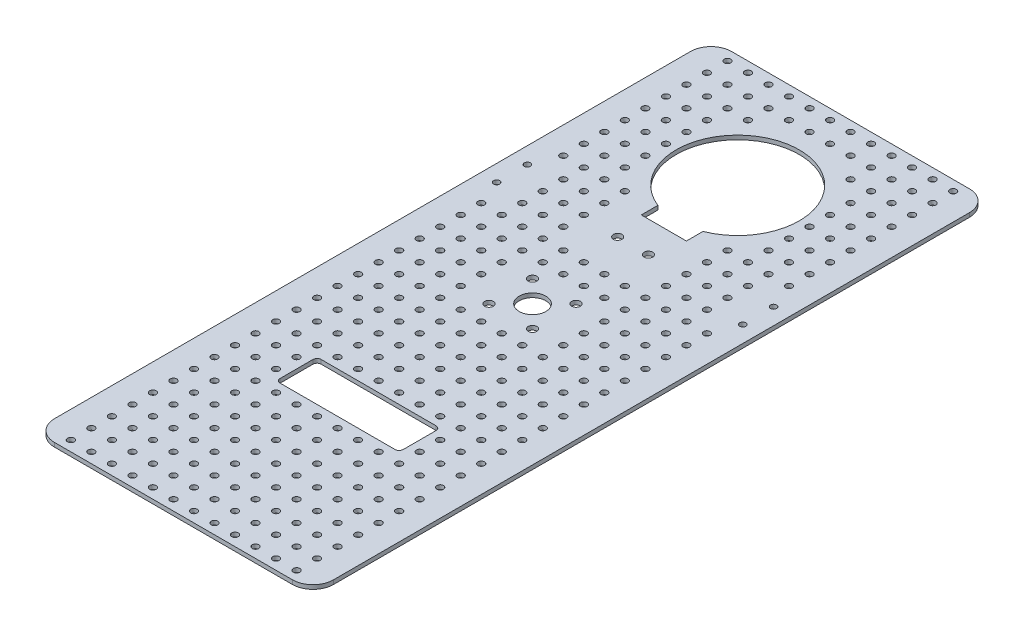
from build123d import *

# Parameters (mm, degrees)
SKETCH_1_W              = 136
SKETCH_1_H              = 330
EXTRUDE_572_DEPTH       = 2
SKETCH_12_R             = 1.5
CUT_EXTRUDE_1067_DEPTH  = 198.111643492
SKETCH_9_R              = 6.5
SKETCH_9_R_2            = 2.1
CUT_EXTRUDE_1882_DEPTH  = 198.111643492
FILLET_4_R              = 10
CUT_EXTRUDE_6977_REACH  = 199.112
SKETCH_18_R             = 2.1
FILLET_9_R              = 10
SKETCH_22_R             = 1.6
CUT_EXTRUDE_10_DEPTH    = 2
SKETCH_11_W             = 60
SKETCH_11_H             = 20
CUT_EXTRUDE_12810_DEPTH = 198.111643492
FILLET_3_R              = 2


with BuildPart() as part:
    # Эскиз1 → Extrude 572 (new body)
    with BuildSketch(Plane(origin=(0, 0, 0), x_dir=(1, 0, 0), z_dir=(0, 1, 0))):
        with Locations((0, -20)):
            Rectangle(SKETCH_1_W, SKETCH_1_H)
    extrude(amount=EXTRUDE_572_DEPTH)

    # Эскиз12 → Cut-Extrude 1067 (cut, through all)
    with BuildSketch(Plane(origin=(0, 2, 0), x_dir=(1, 0, 0), z_dir=(0, 1, 0))):
        with Locations(Location((60, 47.5, 0), (0, 0, 270))):
            Circle(SKETCH_12_R)
        with Locations(Location((-60, 47.5, 0), (0, 0, 270))):
            Circle(SKETCH_12_R)
        with Locations(Location((-60, 32.5, 0), (0, 0, 270))):
            Circle(SKETCH_12_R)
        with Locations(Location((60, 32.5, 0), (0, 0, 270))):
            Circle(SKETCH_12_R)
    extrude(amount=-CUT_EXTRUDE_1067_DEPTH, mode=Mode.SUBTRACT)

    # Эскиз9 → Cut-Extrude 1882 (cut, through all)
    with BuildSketch(Plane(origin=(0, 2, 0), x_dir=(1, 0, 0), z_dir=(0, 1, 0))):
        with Locations(Location((0, -10, 0), (0, 0, 270))):
            Circle(SKETCH_9_R)
        with Locations(Location((-10.606601718, 0.606601718, 0), (0, 0, 270))):
            Circle(SKETCH_9_R_2)
        with Locations(Location((10.606601718, 0.606601718, 0), (0, 0, 270))):
            Circle(SKETCH_9_R_2)
        with Locations(Location((10.606601718, -20.606601718, 0), (0, 0, 270))):
            Circle(SKETCH_9_R_2)
        with Locations(Location((-10.606601718, -20.606601718, 0), (0, 0, 270))):
            Circle(SKETCH_9_R_2)
    extrude(amount=-CUT_EXTRUDE_1882_DEPTH, mode=Mode.SUBTRACT)

    # Скругление4
    fillet_4_edges = [part.edges().sort_by_distance(p)[0] for p in [
        (-68, 1, -145),
        (68, 1, -145),
    ]]
    fillet(fillet_4_edges, radius=FILLET_4_R)

    # Эскиз18 → Cut-Extrude 6977 (cut, up to next)
    with BuildSketch(Plane(origin=(0, 2, 0), x_dir=(1, 0, 0), z_dir=(0, 1, 0)), mode=Mode.PRIVATE) as cut_extrude_6977_sk1:
        with Locations(Location((7.5, 39, 0), (0, 0, 270))):
            Circle(SKETCH_18_R)
    cut_extrude_6977_tool1 = extrude(cut_extrude_6977_sk1.sketch, amount=-CUT_EXTRUDE_6977_REACH, mode=Mode.PRIVATE) & part.part
    # Эскиз18 → Cut-Extrude 6977 (cut, up to next)
    with BuildSketch(Plane(origin=(0, 2, 0), x_dir=(1, 0, 0), z_dir=(0, 1, 0)), mode=Mode.PRIVATE) as cut_extrude_6977_sk2:
        with Locations(Location((-7.5, 39, 0), (0, 0, 270))):
            Circle(SKETCH_18_R)
    cut_extrude_6977_tool2 = extrude(cut_extrude_6977_sk2.sketch, amount=-CUT_EXTRUDE_6977_REACH, mode=Mode.PRIVATE) & part.part
    # Эскиз18 → Cut-Extrude 6977 (cut, up to next)
    with BuildSketch(Plane(origin=(0, 2, 0), x_dir=(1, 0, 0), z_dir=(0, 1, 0)), mode=Mode.PRIVATE) as cut_extrude_6977_sk3:
        with BuildLine():
            Line((-11, 54), (11, 54))
            Line((11, 54), (11, 62.089428526))
            ThreePointArc((11, 62.089428526), (0, 120), (-11, 62.089428526))
            Line((-11, 62.089428526), (-11, 54))
        make_face()
    cut_extrude_6977_tool3 = extrude(cut_extrude_6977_sk3.sketch, amount=-CUT_EXTRUDE_6977_REACH, mode=Mode.PRIVATE) & part.part
    add(cut_extrude_6977_tool1.solids().sort_by_distance((7.5, 2, -39))[0], mode=Mode.SUBTRACT)
    add(cut_extrude_6977_tool2.solids().sort_by_distance((-7.5, 2, -39))[0], mode=Mode.SUBTRACT)
    add(cut_extrude_6977_tool3.solids().sort_by_distance((0, 2, -88.386415))[0], mode=Mode.SUBTRACT)

    # Скругление9
    fillet_9_edges = [part.edges().sort_by_distance(p)[0] for p in [
        (68, 1, 185),
        (-68, 1, 185),
    ]]
    fillet(fillet_9_edges, radius=FILLET_9_R)

    # Эскиз22 → Сетка 10мм (cut)
    with BuildSketch(Plane(origin=(0, 2, 0), x_dir=(1, 0, 0), z_dir=(0, 1, 0))):
        with Locations(Location((-5, -180, 0), (0, 0, 270))):
            Circle(SKETCH_22_R)
        with Locations(Location((-15, -180, 0), (0, 0, 270))):
            Circle(SKETCH_22_R)
        with Locations(Location((-25, -180, 0), (0, 0, 270))):
            Circle(SKETCH_22_R)
        with Locations(Location((-35, -180, 0), (0, 0, 270))):
            Circle(SKETCH_22_R)
        with Locations(Location((-45, -180, 0), (0, 0, 270))):
            Circle(SKETCH_22_R)
        with Locations(Location((-55, -180, 0), (0, 0, 270))):
            Circle(SKETCH_22_R)
        with Locations(Location((5, -180, 0), (0, 0, 270))):
            Circle(SKETCH_22_R)
        with Locations(Location((15, -180, 0), (0, 0, 270))):
            Circle(SKETCH_22_R)
        with Locations(Location((25, -180, 0), (0, 0, 270))):
            Circle(SKETCH_22_R)
        with Locations(Location((35, -180, 0), (0, 0, 270))):
            Circle(SKETCH_22_R)
        with Locations(Location((45, -180, 0), (0, 0, 270))):
            Circle(SKETCH_22_R)
        with Locations(Location((55, -180, 0), (0, 0, 270))):
            Circle(SKETCH_22_R)
        with Locations(Location((-5, -170, 0), (0, 0, 270))):
            Circle(SKETCH_22_R)
        with Locations(Location((-15, -170, 0), (0, 0, 270))):
            Circle(SKETCH_22_R)
        with Locations(Location((-25, -170, 0), (0, 0, 270))):
            Circle(SKETCH_22_R)
        with Locations(Location((-35, -170, 0), (0, 0, 270))):
            Circle(SKETCH_22_R)
        with Locations(Location((-45, -170, 0), (0, 0, 270))):
            Circle(SKETCH_22_R)
        with Locations(Location((-55, -170, 0), (0, 0, 270))):
            Circle(SKETCH_22_R)
        with Locations(Location((5, -170, 0), (0, 0, 270))):
            Circle(SKETCH_22_R)
        with Locations(Location((15, -170, 0), (0, 0, 270))):
            Circle(SKETCH_22_R)
        with Locations(Location((25, -170, 0), (0, 0, 270))):
            Circle(SKETCH_22_R)
        with Locations(Location((35, -170, 0), (0, 0, 270))):
            Circle(SKETCH_22_R)
        with Locations(Location((45, -170, 0), (0, 0, 270))):
            Circle(SKETCH_22_R)
        with Locations(Location((55, -170, 0), (0, 0, 270))):
            Circle(SKETCH_22_R)
        with Locations(Location((-5, -160, 0), (0, 0, 270))):
            Circle(SKETCH_22_R)
        with Locations(Location((-15, -160, 0), (0, 0, 270))):
            Circle(SKETCH_22_R)
        with Locations(Location((-25, -160, 0), (0, 0, 270))):
            Circle(SKETCH_22_R)
        with Locations(Location((-35, -160, 0), (0, 0, 270))):
            Circle(SKETCH_22_R)
        with Locations(Location((-45, -160, 0), (0, 0, 270))):
            Circle(SKETCH_22_R)
        with Locations(Location((-55, -160, 0), (0, 0, 270))):
            Circle(SKETCH_22_R)
        with Locations(Location((5, -160, 0), (0, 0, 270))):
            Circle(SKETCH_22_R)
        with Locations(Location((15, -160, 0), (0, 0, 270))):
            Circle(SKETCH_22_R)
        with Locations(Location((25, -160, 0), (0, 0, 270))):
            Circle(SKETCH_22_R)
        with Locations(Location((35, -160, 0), (0, 0, 270))):
            Circle(SKETCH_22_R)
        with Locations(Location((45, -160, 0), (0, 0, 270))):
            Circle(SKETCH_22_R)
        with Locations(Location((55, -160, 0), (0, 0, 270))):
            Circle(SKETCH_22_R)
        with Locations(Location((-5, -150, 0), (0, 0, 270))):
            Circle(SKETCH_22_R)
        with Locations(Location((-15, -150, 0), (0, 0, 270))):
            Circle(SKETCH_22_R)
        with Locations(Location((-25, -150, 0), (0, 0, 270))):
            Circle(SKETCH_22_R)
        with Locations(Location((-35, -150, 0), (0, 0, 270))):
            Circle(SKETCH_22_R)
        with Locations(Location((-45, -150, 0), (0, 0, 270))):
            Circle(SKETCH_22_R)
        with Locations(Location((-55, -150, 0), (0, 0, 270))):
            Circle(SKETCH_22_R)
        with Locations(Location((5, -150, 0), (0, 0, 270))):
            Circle(SKETCH_22_R)
        with Locations(Location((15, -150, 0), (0, 0, 270))):
            Circle(SKETCH_22_R)
        with Locations(Location((25, -150, 0), (0, 0, 270))):
            Circle(SKETCH_22_R)
        with Locations(Location((35, -150, 0), (0, 0, 270))):
            Circle(SKETCH_22_R)
        with Locations(Location((45, -150, 0), (0, 0, 270))):
            Circle(SKETCH_22_R)
        with Locations(Location((55, -150, 0), (0, 0, 270))):
            Circle(SKETCH_22_R)
        with Locations(Location((-5, -140, 0), (0, 0, 270))):
            Circle(SKETCH_22_R)
        with Locations(Location((-15, -140, 0), (0, 0, 270))):
            Circle(SKETCH_22_R)
        with Locations(Location((-25, -140, 0), (0, 0, 270))):
            Circle(SKETCH_22_R)
        with Locations(Location((-35, -140, 0), (0, 0, 270))):
            Circle(SKETCH_22_R)
        with Locations(Location((-45, -140, 0), (0, 0, 270))):
            Circle(SKETCH_22_R)
        with Locations(Location((-55, -140, 0), (0, 0, 270))):
            Circle(SKETCH_22_R)
        with Locations(Location((5, -140, 0), (0, 0, 270))):
            Circle(SKETCH_22_R)
        with Locations(Location((15, -140, 0), (0, 0, 270))):
            Circle(SKETCH_22_R)
        with Locations(Location((25, -140, 0), (0, 0, 270))):
            Circle(SKETCH_22_R)
        with Locations(Location((35, -140, 0), (0, 0, 270))):
            Circle(SKETCH_22_R)
        with Locations(Location((45, -140, 0), (0, 0, 270))):
            Circle(SKETCH_22_R)
        with Locations(Location((55, -140, 0), (0, 0, 270))):
            Circle(SKETCH_22_R)
        with Locations(Location((-5, -130, 0), (0, 0, 270))):
            Circle(SKETCH_22_R)
        with Locations(Location((-15, -130, 0), (0, 0, 270))):
            Circle(SKETCH_22_R)
        with Locations(Location((-25, -130, 0), (0, 0, 270))):
            Circle(SKETCH_22_R)
        with Locations(Location((-35, -130, 0), (0, 0, 270))):
            Circle(SKETCH_22_R)
        with Locations(Location((-45, -130, 0), (0, 0, 270))):
            Circle(SKETCH_22_R)
        with Locations(Location((-55, -130, 0), (0, 0, 270))):
            Circle(SKETCH_22_R)
        with Locations(Location((5, -130, 0), (0, 0, 270))):
            Circle(SKETCH_22_R)
        with Locations(Location((15, -130, 0), (0, 0, 270))):
            Circle(SKETCH_22_R)
        with Locations(Location((25, -130, 0), (0, 0, 270))):
            Circle(SKETCH_22_R)
        with Locations(Location((35, -130, 0), (0, 0, 270))):
            Circle(SKETCH_22_R)
        with Locations(Location((45, -130, 0), (0, 0, 270))):
            Circle(SKETCH_22_R)
        with Locations(Location((55, -130, 0), (0, 0, 270))):
            Circle(SKETCH_22_R)
        with Locations(Location((-5, -120, 0), (0, 0, 270))):
            Circle(SKETCH_22_R)
        with Locations(Location((-15, -120, 0), (0, 0, 270))):
            Circle(SKETCH_22_R)
        with Locations(Location((-25, -120, 0), (0, 0, 270))):
            Circle(SKETCH_22_R)
        with Locations(Location((-35, -120, 0), (0, 0, 270))):
            Circle(SKETCH_22_R)
        with Locations(Location((-45, -120, 0), (0, 0, 270))):
            Circle(SKETCH_22_R)
        with Locations(Location((-55, -120, 0), (0, 0, 270))):
            Circle(SKETCH_22_R)
        with Locations(Location((5, -120, 0), (0, 0, 270))):
            Circle(SKETCH_22_R)
        with Locations(Location((15, -120, 0), (0, 0, 270))):
            Circle(SKETCH_22_R)
        with Locations(Location((25, -120, 0), (0, 0, 270))):
            Circle(SKETCH_22_R)
        with Locations(Location((35, -120, 0), (0, 0, 270))):
            Circle(SKETCH_22_R)
        with Locations(Location((45, -120, 0), (0, 0, 270))):
            Circle(SKETCH_22_R)
        with Locations(Location((55, -120, 0), (0, 0, 270))):
            Circle(SKETCH_22_R)
        with Locations(Location((-5, -110, 0), (0, 0, 270))):
            Circle(SKETCH_22_R)
        with Locations(Location((-15, -110, 0), (0, 0, 270))):
            Circle(SKETCH_22_R)
        with Locations(Location((-25, -110, 0), (0, 0, 270))):
            Circle(SKETCH_22_R)
        with Locations(Location((-35, -110, 0), (0, 0, 270))):
            Circle(SKETCH_22_R)
        with Locations(Location((-45, -110, 0), (0, 0, 270))):
            Circle(SKETCH_22_R)
        with Locations(Location((-55, -110, 0), (0, 0, 270))):
            Circle(SKETCH_22_R)
        with Locations(Location((5, -110, 0), (0, 0, 270))):
            Circle(SKETCH_22_R)
        with Locations(Location((15, -110, 0), (0, 0, 270))):
            Circle(SKETCH_22_R)
        with Locations(Location((25, -110, 0), (0, 0, 270))):
            Circle(SKETCH_22_R)
        with Locations(Location((35, -110, 0), (0, 0, 270))):
            Circle(SKETCH_22_R)
        with Locations(Location((45, -110, 0), (0, 0, 270))):
            Circle(SKETCH_22_R)
        with Locations(Location((55, -110, 0), (0, 0, 270))):
            Circle(SKETCH_22_R)
        with Locations(Location((-35, -100, 0), (0, 0, 270))):
            Circle(SKETCH_22_R)
        with Locations(Location((-45, -100, 0), (0, 0, 270))):
            Circle(SKETCH_22_R)
        with Locations(Location((-55, -100, 0), (0, 0, 270))):
            Circle(SKETCH_22_R)
        with Locations(Location((35, -100, 0), (0, 0, 270))):
            Circle(SKETCH_22_R)
        with Locations(Location((45, -100, 0), (0, 0, 270))):
            Circle(SKETCH_22_R)
        with Locations(Location((55, -100, 0), (0, 0, 270))):
            Circle(SKETCH_22_R)
        with Locations(Location((-35, -90, 0), (0, 0, 270))):
            Circle(SKETCH_22_R)
        with Locations(Location((-45, -90, 0), (0, 0, 270))):
            Circle(SKETCH_22_R)
        with Locations(Location((-55, -90, 0), (0, 0, 270))):
            Circle(SKETCH_22_R)
        with Locations(Location((35, -90, 0), (0, 0, 270))):
            Circle(SKETCH_22_R)
        with Locations(Location((45, -90, 0), (0, 0, 270))):
            Circle(SKETCH_22_R)
        with Locations(Location((55, -90, 0), (0, 0, 270))):
            Circle(SKETCH_22_R)
        with Locations(Location((-5, -80, 0), (0, 0, 270))):
            Circle(SKETCH_22_R)
        with Locations(Location((-15, -80, 0), (0, 0, 270))):
            Circle(SKETCH_22_R)
        with Locations(Location((-25, -80, 0), (0, 0, 270))):
            Circle(SKETCH_22_R)
        with Locations(Location((-35, -80, 0), (0, 0, 270))):
            Circle(SKETCH_22_R)
        with Locations(Location((-45, -80, 0), (0, 0, 270))):
            Circle(SKETCH_22_R)
        with Locations(Location((-55, -80, 0), (0, 0, 270))):
            Circle(SKETCH_22_R)
        with Locations(Location((5, -80, 0), (0, 0, 270))):
            Circle(SKETCH_22_R)
        with Locations(Location((15, -80, 0), (0, 0, 270))):
            Circle(SKETCH_22_R)
        with Locations(Location((25, -80, 0), (0, 0, 270))):
            Circle(SKETCH_22_R)
        with Locations(Location((35, -80, 0), (0, 0, 270))):
            Circle(SKETCH_22_R)
        with Locations(Location((45, -80, 0), (0, 0, 270))):
            Circle(SKETCH_22_R)
        with Locations(Location((55, -80, 0), (0, 0, 270))):
            Circle(SKETCH_22_R)
        with Locations(Location((-5, -70, 0), (0, 0, 270))):
            Circle(SKETCH_22_R)
        with Locations(Location((-15, -70, 0), (0, 0, 270))):
            Circle(SKETCH_22_R)
        with Locations(Location((-25, -70, 0), (0, 0, 270))):
            Circle(SKETCH_22_R)
        with Locations(Location((-35, -70, 0), (0, 0, 270))):
            Circle(SKETCH_22_R)
        with Locations(Location((-45, -70, 0), (0, 0, 270))):
            Circle(SKETCH_22_R)
        with Locations(Location((-55, -70, 0), (0, 0, 270))):
            Circle(SKETCH_22_R)
        with Locations(Location((5, -70, 0), (0, 0, 270))):
            Circle(SKETCH_22_R)
        with Locations(Location((15, -70, 0), (0, 0, 270))):
            Circle(SKETCH_22_R)
        with Locations(Location((25, -70, 0), (0, 0, 270))):
            Circle(SKETCH_22_R)
        with Locations(Location((35, -70, 0), (0, 0, 270))):
            Circle(SKETCH_22_R)
        with Locations(Location((45, -70, 0), (0, 0, 270))):
            Circle(SKETCH_22_R)
        with Locations(Location((55, -70, 0), (0, 0, 270))):
            Circle(SKETCH_22_R)
        with Locations(Location((-5, -60, 0), (0, 0, 270))):
            Circle(SKETCH_22_R)
        with Locations(Location((-15, -60, 0), (0, 0, 270))):
            Circle(SKETCH_22_R)
        with Locations(Location((-25, -60, 0), (0, 0, 270))):
            Circle(SKETCH_22_R)
        with Locations(Location((-35, -60, 0), (0, 0, 270))):
            Circle(SKETCH_22_R)
        with Locations(Location((-45, -60, 0), (0, 0, 270))):
            Circle(SKETCH_22_R)
        with Locations(Location((-55, -60, 0), (0, 0, 270))):
            Circle(SKETCH_22_R)
        with Locations(Location((5, -60, 0), (0, 0, 270))):
            Circle(SKETCH_22_R)
        with Locations(Location((15, -60, 0), (0, 0, 270))):
            Circle(SKETCH_22_R)
        with Locations(Location((25, -60, 0), (0, 0, 270))):
            Circle(SKETCH_22_R)
        with Locations(Location((35, -60, 0), (0, 0, 270))):
            Circle(SKETCH_22_R)
        with Locations(Location((45, -60, 0), (0, 0, 270))):
            Circle(SKETCH_22_R)
        with Locations(Location((55, -60, 0), (0, 0, 270))):
            Circle(SKETCH_22_R)
        with Locations(Location((-5, -50, 0), (0, 0, 270))):
            Circle(SKETCH_22_R)
        with Locations(Location((-15, -50, 0), (0, 0, 270))):
            Circle(SKETCH_22_R)
        with Locations(Location((-25, -50, 0), (0, 0, 270))):
            Circle(SKETCH_22_R)
        with Locations(Location((-35, -50, 0), (0, 0, 270))):
            Circle(SKETCH_22_R)
        with Locations(Location((-45, -50, 0), (0, 0, 270))):
            Circle(SKETCH_22_R)
        with Locations(Location((-55, -50, 0), (0, 0, 270))):
            Circle(SKETCH_22_R)
        with Locations(Location((5, -50, 0), (0, 0, 270))):
            Circle(SKETCH_22_R)
        with Locations(Location((15, -50, 0), (0, 0, 270))):
            Circle(SKETCH_22_R)
        with Locations(Location((25, -50, 0), (0, 0, 270))):
            Circle(SKETCH_22_R)
        with Locations(Location((35, -50, 0), (0, 0, 270))):
            Circle(SKETCH_22_R)
        with Locations(Location((45, -50, 0), (0, 0, 270))):
            Circle(SKETCH_22_R)
        with Locations(Location((55, -50, 0), (0, 0, 270))):
            Circle(SKETCH_22_R)
        with Locations(Location((-5, -40, 0), (0, 0, 270))):
            Circle(SKETCH_22_R)
        with Locations(Location((-15, -40, 0), (0, 0, 270))):
            Circle(SKETCH_22_R)
        with Locations(Location((-25, -40, 0), (0, 0, 270))):
            Circle(SKETCH_22_R)
        with Locations(Location((-35, -40, 0), (0, 0, 270))):
            Circle(SKETCH_22_R)
        with Locations(Location((-45, -40, 0), (0, 0, 270))):
            Circle(SKETCH_22_R)
        with Locations(Location((-55, -40, 0), (0, 0, 270))):
            Circle(SKETCH_22_R)
        with Locations(Location((5, -40, 0), (0, 0, 270))):
            Circle(SKETCH_22_R)
        with Locations(Location((15, -40, 0), (0, 0, 270))):
            Circle(SKETCH_22_R)
        with Locations(Location((25, -40, 0), (0, 0, 270))):
            Circle(SKETCH_22_R)
        with Locations(Location((35, -40, 0), (0, 0, 270))):
            Circle(SKETCH_22_R)
        with Locations(Location((45, -40, 0), (0, 0, 270))):
            Circle(SKETCH_22_R)
        with Locations(Location((55, -40, 0), (0, 0, 270))):
            Circle(SKETCH_22_R)
        with Locations(Location((-5, -30, 0), (0, 0, 270))):
            Circle(SKETCH_22_R)
        with Locations(Location((-15, -30, 0), (0, 0, 270))):
            Circle(SKETCH_22_R)
        with Locations(Location((-25, -30, 0), (0, 0, 270))):
            Circle(SKETCH_22_R)
        with Locations(Location((-35, -30, 0), (0, 0, 270))):
            Circle(SKETCH_22_R)
        with Locations(Location((-45, -30, 0), (0, 0, 270))):
            Circle(SKETCH_22_R)
        with Locations(Location((-55, -30, 0), (0, 0, 270))):
            Circle(SKETCH_22_R)
        with Locations(Location((5, -30, 0), (0, 0, 270))):
            Circle(SKETCH_22_R)
        with Locations(Location((15, -30, 0), (0, 0, 270))):
            Circle(SKETCH_22_R)
        with Locations(Location((25, -30, 0), (0, 0, 270))):
            Circle(SKETCH_22_R)
        with Locations(Location((35, -30, 0), (0, 0, 270))):
            Circle(SKETCH_22_R)
        with Locations(Location((45, -30, 0), (0, 0, 270))):
            Circle(SKETCH_22_R)
        with Locations(Location((55, -30, 0), (0, 0, 270))):
            Circle(SKETCH_22_R)
        with Locations(Location((-25, -20, 0), (0, 0, 270))):
            Circle(SKETCH_22_R)
        with Locations(Location((-35, -20, 0), (0, 0, 270))):
            Circle(SKETCH_22_R)
        with Locations(Location((-45, -20, 0), (0, 0, 270))):
            Circle(SKETCH_22_R)
        with Locations(Location((-55, -20, 0), (0, 0, 270))):
            Circle(SKETCH_22_R)
        with Locations(Location((25, -20, 0), (0, 0, 270))):
            Circle(SKETCH_22_R)
        with Locations(Location((35, -20, 0), (0, 0, 270))):
            Circle(SKETCH_22_R)
        with Locations(Location((45, -20, 0), (0, 0, 270))):
            Circle(SKETCH_22_R)
        with Locations(Location((55, -20, 0), (0, 0, 270))):
            Circle(SKETCH_22_R)
        with Locations(Location((-25, -10, 0), (0, 0, 270))):
            Circle(SKETCH_22_R)
        with Locations(Location((-35, -10, 0), (0, 0, 270))):
            Circle(SKETCH_22_R)
        with Locations(Location((-45, -10, 0), (0, 0, 270))):
            Circle(SKETCH_22_R)
        with Locations(Location((-55, -10, 0), (0, 0, 270))):
            Circle(SKETCH_22_R)
        with Locations(Location((25, -10, 0), (0, 0, 270))):
            Circle(SKETCH_22_R)
        with Locations(Location((35, -10, 0), (0, 0, 270))):
            Circle(SKETCH_22_R)
        with Locations(Location((45, -10, 0), (0, 0, 270))):
            Circle(SKETCH_22_R)
        with Locations(Location((55, -10, 0), (0, 0, 270))):
            Circle(SKETCH_22_R)
        with Locations(Location((-25, 0, 0), (0, 0, 270))):
            Circle(SKETCH_22_R)
        with Locations(Location((-35, 0, 0), (0, 0, 270))):
            Circle(SKETCH_22_R)
        with Locations(Location((-45, 0, 0), (0, 0, 270))):
            Circle(SKETCH_22_R)
        with Locations(Location((-55, 0, 0), (0, 0, 270))):
            Circle(SKETCH_22_R)
        with Locations(Location((25, 0, 0), (0, 0, 270))):
            Circle(SKETCH_22_R)
        with Locations(Location((35, 0, 0), (0, 0, 270))):
            Circle(SKETCH_22_R)
        with Locations(Location((45, 0, 0), (0, 0, 270))):
            Circle(SKETCH_22_R)
        with Locations(Location((55, 0, 0), (0, 0, 270))):
            Circle(SKETCH_22_R)
        with Locations(Location((-5, 10, 0), (0, 0, 270))):
            Circle(SKETCH_22_R)
        with Locations(Location((-15, 10, 0), (0, 0, 270))):
            Circle(SKETCH_22_R)
        with Locations(Location((-25, 10, 0), (0, 0, 270))):
            Circle(SKETCH_22_R)
        with Locations(Location((-35, 10, 0), (0, 0, 270))):
            Circle(SKETCH_22_R)
        with Locations(Location((-45, 10, 0), (0, 0, 270))):
            Circle(SKETCH_22_R)
        with Locations(Location((-55, 10, 0), (0, 0, 270))):
            Circle(SKETCH_22_R)
        with Locations(Location((5, 10, 0), (0, 0, 270))):
            Circle(SKETCH_22_R)
        with Locations(Location((15, 10, 0), (0, 0, 270))):
            Circle(SKETCH_22_R)
        with Locations(Location((25, 10, 0), (0, 0, 270))):
            Circle(SKETCH_22_R)
        with Locations(Location((35, 10, 0), (0, 0, 270))):
            Circle(SKETCH_22_R)
        with Locations(Location((45, 10, 0), (0, 0, 270))):
            Circle(SKETCH_22_R)
        with Locations(Location((55, 10, 0), (0, 0, 270))):
            Circle(SKETCH_22_R)
        with Locations(Location((-5, 20, 0), (0, 0, 270))):
            Circle(SKETCH_22_R)
        with Locations(Location((-15, 20, 0), (0, 0, 270))):
            Circle(SKETCH_22_R)
        with Locations(Location((-25, 20, 0), (0, 0, 270))):
            Circle(SKETCH_22_R)
        with Locations(Location((-35, 20, 0), (0, 0, 270))):
            Circle(SKETCH_22_R)
        with Locations(Location((-45, 20, 0), (0, 0, 270))):
            Circle(SKETCH_22_R)
        with Locations(Location((-55, 20, 0), (0, 0, 270))):
            Circle(SKETCH_22_R)
        with Locations(Location((5, 20, 0), (0, 0, 270))):
            Circle(SKETCH_22_R)
        with Locations(Location((15, 20, 0), (0, 0, 270))):
            Circle(SKETCH_22_R)
        with Locations(Location((25, 20, 0), (0, 0, 270))):
            Circle(SKETCH_22_R)
        with Locations(Location((35, 20, 0), (0, 0, 270))):
            Circle(SKETCH_22_R)
        with Locations(Location((45, 20, 0), (0, 0, 270))):
            Circle(SKETCH_22_R)
        with Locations(Location((55, 20, 0), (0, 0, 270))):
            Circle(SKETCH_22_R)
        with Locations(Location((-25, 30, 0), (0, 0, 270))):
            Circle(SKETCH_22_R)
        with Locations(Location((-35, 30, 0), (0, 0, 270))):
            Circle(SKETCH_22_R)
        with Locations(Location((-45, 30, 0), (0, 0, 270))):
            Circle(SKETCH_22_R)
        with Locations(Location((25, 30, 0), (0, 0, 270))):
            Circle(SKETCH_22_R)
        with Locations(Location((35, 30, 0), (0, 0, 270))):
            Circle(SKETCH_22_R)
        with Locations(Location((45, 30, 0), (0, 0, 270))):
            Circle(SKETCH_22_R)
        with Locations(Location((-25, 40, 0), (0, 0, 270))):
            Circle(SKETCH_22_R)
        with Locations(Location((-35, 40, 0), (0, 0, 270))):
            Circle(SKETCH_22_R)
        with Locations(Location((-45, 40, 0), (0, 0, 270))):
            Circle(SKETCH_22_R)
        with Locations(Location((25, 40, 0), (0, 0, 270))):
            Circle(SKETCH_22_R)
        with Locations(Location((35, 40, 0), (0, 0, 270))):
            Circle(SKETCH_22_R)
        with Locations(Location((45, 40, 0), (0, 0, 270))):
            Circle(SKETCH_22_R)
        with Locations(Location((-25, 50, 0), (0, 0, 270))):
            Circle(SKETCH_22_R)
        with Locations(Location((-35, 50, 0), (0, 0, 270))):
            Circle(SKETCH_22_R)
        with Locations(Location((-45, 50, 0), (0, 0, 270))):
            Circle(SKETCH_22_R)
        with Locations(Location((25, 50, 0), (0, 0, 270))):
            Circle(SKETCH_22_R)
        with Locations(Location((35, 50, 0), (0, 0, 270))):
            Circle(SKETCH_22_R)
        with Locations(Location((45, 50, 0), (0, 0, 270))):
            Circle(SKETCH_22_R)
        with Locations(Location((-25, 60, 0), (0, 0, 270))):
            Circle(SKETCH_22_R)
        with Locations(Location((-35, 60, 0), (0, 0, 270))):
            Circle(SKETCH_22_R)
        with Locations(Location((-45, 60, 0), (0, 0, 270))):
            Circle(SKETCH_22_R)
        with Locations(Location((-55, 60, 0), (0, 0, 270))):
            Circle(SKETCH_22_R)
        with Locations(Location((25, 60, 0), (0, 0, 270))):
            Circle(SKETCH_22_R)
        with Locations(Location((35, 60, 0), (0, 0, 270))):
            Circle(SKETCH_22_R)
        with Locations(Location((45, 60, 0), (0, 0, 270))):
            Circle(SKETCH_22_R)
        with Locations(Location((55, 60, 0), (0, 0, 270))):
            Circle(SKETCH_22_R)
        with Locations(Location((-35, 70, 0), (0, 0, 270))):
            Circle(SKETCH_22_R)
        with Locations(Location((-45, 70, 0), (0, 0, 270))):
            Circle(SKETCH_22_R)
        with Locations(Location((-55, 70, 0), (0, 0, 270))):
            Circle(SKETCH_22_R)
        with Locations(Location((35, 70, 0), (0, 0, 270))):
            Circle(SKETCH_22_R)
        with Locations(Location((45, 70, 0), (0, 0, 270))):
            Circle(SKETCH_22_R)
        with Locations(Location((55, 70, 0), (0, 0, 270))):
            Circle(SKETCH_22_R)
        with Locations(Location((-35, 80, 0), (0, 0, 270))):
            Circle(SKETCH_22_R)
        with Locations(Location((-45, 80, 0), (0, 0, 270))):
            Circle(SKETCH_22_R)
        with Locations(Location((-55, 80, 0), (0, 0, 270))):
            Circle(SKETCH_22_R)
        with Locations(Location((35, 80, 0), (0, 0, 270))):
            Circle(SKETCH_22_R)
        with Locations(Location((45, 80, 0), (0, 0, 270))):
            Circle(SKETCH_22_R)
        with Locations(Location((55, 80, 0), (0, 0, 270))):
            Circle(SKETCH_22_R)
        with Locations(Location((-35, 90, 0), (0, 0, 270))):
            Circle(SKETCH_22_R)
        with Locations(Location((-45, 90, 0), (0, 0, 270))):
            Circle(SKETCH_22_R)
        with Locations(Location((-55, 90, 0), (0, 0, 270))):
            Circle(SKETCH_22_R)
        with Locations(Location((35, 90, 0), (0, 0, 270))):
            Circle(SKETCH_22_R)
        with Locations(Location((45, 90, 0), (0, 0, 270))):
            Circle(SKETCH_22_R)
        with Locations(Location((55, 90, 0), (0, 0, 270))):
            Circle(SKETCH_22_R)
        with Locations(Location((-35, 100, 0), (0, 0, 270))):
            Circle(SKETCH_22_R)
        with Locations(Location((-45, 100, 0), (0, 0, 270))):
            Circle(SKETCH_22_R)
        with Locations(Location((-55, 100, 0), (0, 0, 270))):
            Circle(SKETCH_22_R)
        with Locations(Location((35, 100, 0), (0, 0, 270))):
            Circle(SKETCH_22_R)
        with Locations(Location((45, 100, 0), (0, 0, 270))):
            Circle(SKETCH_22_R)
        with Locations(Location((55, 100, 0), (0, 0, 270))):
            Circle(SKETCH_22_R)
        with Locations(Location((-35, 110, 0), (0, 0, 270))):
            Circle(SKETCH_22_R)
        with Locations(Location((-45, 110, 0), (0, 0, 270))):
            Circle(SKETCH_22_R)
        with Locations(Location((-55, 110, 0), (0, 0, 270))):
            Circle(SKETCH_22_R)
        with Locations(Location((35, 110, 0), (0, 0, 270))):
            Circle(SKETCH_22_R)
        with Locations(Location((45, 110, 0), (0, 0, 270))):
            Circle(SKETCH_22_R)
        with Locations(Location((55, 110, 0), (0, 0, 270))):
            Circle(SKETCH_22_R)
        with Locations(Location((-25, 120, 0), (0, 0, 270))):
            Circle(SKETCH_22_R)
        with Locations(Location((-35, 120, 0), (0, 0, 270))):
            Circle(SKETCH_22_R)
        with Locations(Location((-45, 120, 0), (0, 0, 270))):
            Circle(SKETCH_22_R)
        with Locations(Location((-55, 120, 0), (0, 0, 270))):
            Circle(SKETCH_22_R)
        with Locations(Location((25, 120, 0), (0, 0, 270))):
            Circle(SKETCH_22_R)
        with Locations(Location((35, 120, 0), (0, 0, 270))):
            Circle(SKETCH_22_R)
        with Locations(Location((45, 120, 0), (0, 0, 270))):
            Circle(SKETCH_22_R)
        with Locations(Location((55, 120, 0), (0, 0, 270))):
            Circle(SKETCH_22_R)
        with Locations(Location((-5, 130, 0), (0, 0, 270))):
            Circle(SKETCH_22_R)
        with Locations(Location((-15, 130, 0), (0, 0, 270))):
            Circle(SKETCH_22_R)
        with Locations(Location((-25, 130, 0), (0, 0, 270))):
            Circle(SKETCH_22_R)
        with Locations(Location((-35, 130, 0), (0, 0, 270))):
            Circle(SKETCH_22_R)
        with Locations(Location((-45, 130, 0), (0, 0, 270))):
            Circle(SKETCH_22_R)
        with Locations(Location((-55, 130, 0), (0, 0, 270))):
            Circle(SKETCH_22_R)
        with Locations(Location((5, 130, 0), (0, 0, 270))):
            Circle(SKETCH_22_R)
        with Locations(Location((15, 130, 0), (0, 0, 270))):
            Circle(SKETCH_22_R)
        with Locations(Location((25, 130, 0), (0, 0, 270))):
            Circle(SKETCH_22_R)
        with Locations(Location((35, 130, 0), (0, 0, 270))):
            Circle(SKETCH_22_R)
        with Locations(Location((45, 130, 0), (0, 0, 270))):
            Circle(SKETCH_22_R)
        with Locations(Location((55, 130, 0), (0, 0, 270))):
            Circle(SKETCH_22_R)
        with Locations(Location((-5, 140, 0), (0, 0, 270))):
            Circle(SKETCH_22_R)
        with Locations(Location((-15, 140, 0), (0, 0, 270))):
            Circle(SKETCH_22_R)
        with Locations(Location((-25, 140, 0), (0, 0, 270))):
            Circle(SKETCH_22_R)
        with Locations(Location((-35, 140, 0), (0, 0, 270))):
            Circle(SKETCH_22_R)
        with Locations(Location((-45, 140, 0), (0, 0, 270))):
            Circle(SKETCH_22_R)
        with Locations(Location((-55, 140, 0), (0, 0, 270))):
            Circle(SKETCH_22_R)
        with Locations(Location((5, 140, 0), (0, 0, 270))):
            Circle(SKETCH_22_R)
        with Locations(Location((15, 140, 0), (0, 0, 270))):
            Circle(SKETCH_22_R)
        with Locations(Location((25, 140, 0), (0, 0, 270))):
            Circle(SKETCH_22_R)
        with Locations(Location((35, 140, 0), (0, 0, 270))):
            Circle(SKETCH_22_R)
        with Locations(Location((45, 140, 0), (0, 0, 270))):
            Circle(SKETCH_22_R)
        with Locations(Location((55, 140, 0), (0, 0, 270))):
            Circle(SKETCH_22_R)
    extrude(amount=-CUT_EXTRUDE_10_DEPTH, mode=Mode.SUBTRACT)

    # Эскиз11 → Cut-Extrude 12810 (cut, through all)
    with BuildSketch(Plane(origin=(0, 2, 0), x_dir=(1, 0, 0), z_dir=(0, 1, 0))):
        with Locations((0, -95)):
            Rectangle(SKETCH_11_W, SKETCH_11_H)
    extrude(amount=-CUT_EXTRUDE_12810_DEPTH, mode=Mode.SUBTRACT)

    # Скругление3
    fillet_3_edges = [part.edges().sort_by_distance(p)[0] for p in [
        (-30, 1, 105),
        (-30, 1, 85),
        (30, 1, 85),
        (30, 1, 105),
    ]]
    fillet(fillet_3_edges, radius=FILLET_3_R)


solid = part.part
